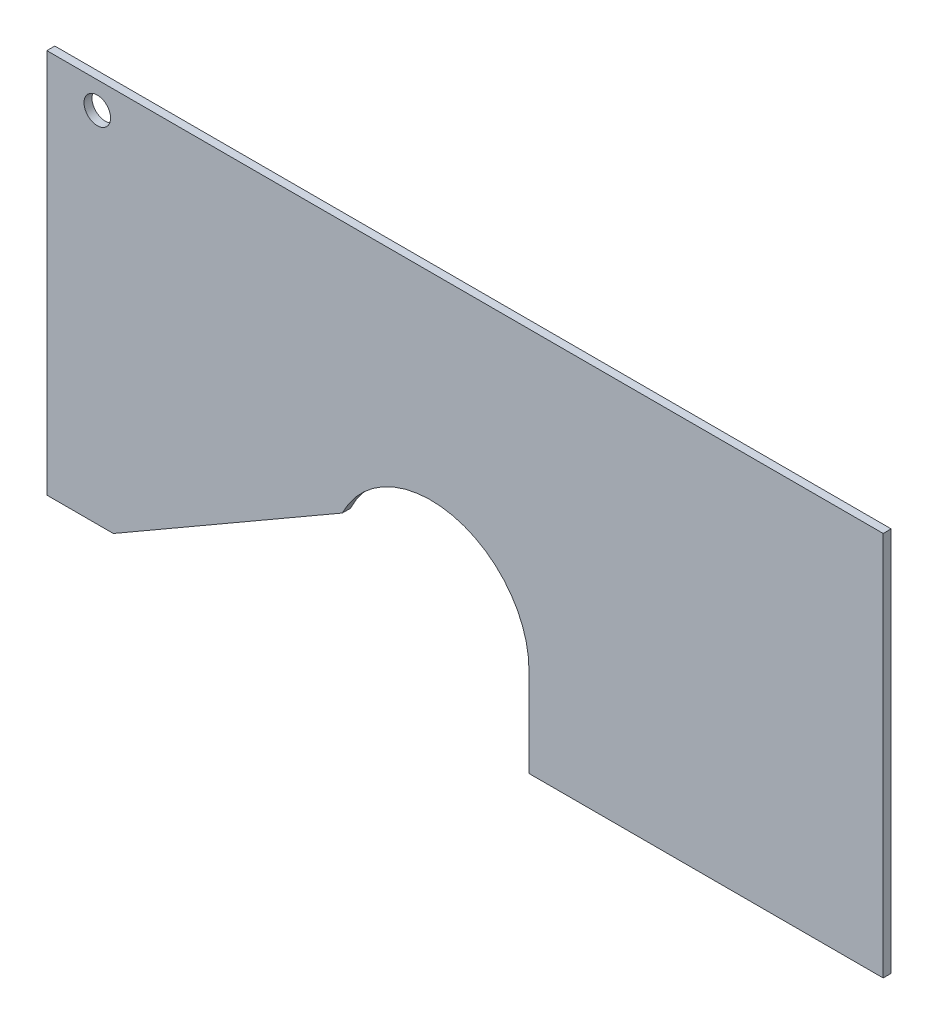
from build123d import *

# Parameters (mm, degrees)
SKETCH2_R           = 5
BOSS_EXTRUDE2_DEPTH = 3


with BuildPart() as part:
    # Sketch2 → Boss-Extrude2 (new body)
    with BuildSketch(Plane.XY):
        with BuildLine():
            Line((25.03035901, 0), (111.286489227, 49.8))
            ThreePointArc((111.286489227, 49.8), (152.858332199, 69.766604349), (181.6, 33.7))
            Line((181.6, 33.7), (181.6, 0))
            Line((181.6, 0), (315, 0))
            Line((315, 0), (315, 145))
            Line((315, 145), (0, 145))
            Line((0, 145), (0, 0))
            Line((0, 0), (25.03035901, 0))
        make_face()
        with Locations((19, 135)):
            Circle(SKETCH2_R, mode=Mode.SUBTRACT)
    extrude(amount=BOSS_EXTRUDE2_DEPTH)


solid = part.part
